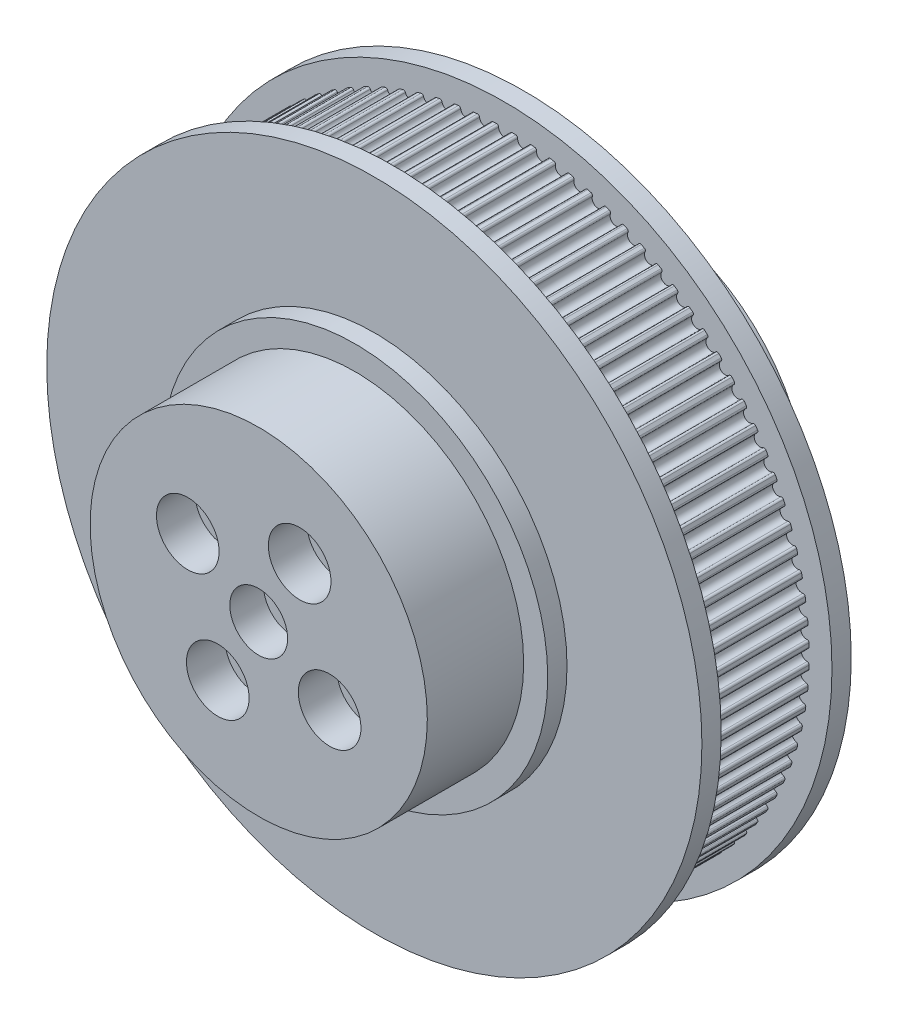
from build123d import *

# Parameters (mm, degrees)
SKETCHREVOLVEGEARBELT01_W       = 11.5
SKETCHREVOLVEGEARBELT01_H       = 31.640488143
TOOTHEXTRUDECUTGEARBELT01_DEPTH = 11.5
PATTERNGEARBELT01_COUNT         = 100
SKETCH_5_R                      = 34
EXTRUDE_1_DEPTH                 = 2
EXTRUDE_START                   = 2
SKETCH_20_R                     = 34
EXTRUDE_10_DEPTH                = 2
SKETCH_12_R                     = 20
EXTRUDE_5_DEPTH                 = 2
SKETCH_6_R                      = 20
EXTRUDE_6_DEPTH                 = 2
SKETCH_13_R                     = 17.5
EXTRUDE_7_DEPTH                 = 10
EXTRUDE_START_2                 = 10
SKETCH_14_R                     = 17.5
EXTRUDE_8_DEPTH                 = 10
SKETCH_15_R                     = 12
CUT_EXTRUDE_1_DEPTH             = 7
CUT_EXTRUDE_2_DEPTH             = 55.426556018
CUT_EXTRUDE_2_DEPTH_BACK        = 55.426556018
SKETCH_16_R                     = 1.75
SKETCH_17_R                     = 3.25
CUT_EXTRUDE_3_DEPTH             = 4
SKETCH_18_R                     = 3
CUT_EXTRUDE_4_DEPTH             = 3.5
CUT_EXTRUDE_5_DEPTH             = 55.426556018
CUT_EXTRUDE_5_DEPTH_BACK        = 55.426556018
SKETCH_19_R                     = 1


with BuildPart() as part:
    # SketchRevolveGearBelt01 → GearBelt01 (revolve)
    with BuildSketch(Plane(origin=(0, 0, 0), x_dir=(0, 0, -1), z_dir=(1, 0, 0))):
        with Locations((5.75, 15.820244072)):
            Rectangle(SKETCHREVOLVEGEARBELT01_W, SKETCHREVOLVEGEARBELT01_H)
    revolve(axis=Axis((0, 0, 0), (0, 0, -1)))

    # SketchToothGearBelt01 → ToothExtrudeCutGearBelt01 (cut)
    with BuildSketch(Plane.XY):
        with BuildLine():
            Line((-0.813963777, 31.630016644), (0, 34.180488105))
            Line((0, 34.180488105), (0.813963777, 31.630016644))
            ThreePointArc((0.813963777, 31.630016644), (0.663006412, 31.570874086), (0.599999991, 31.421488146))
            ThreePointArc((0.599999991, 31.421488146), (0, 30.821488155), (-0.599999991, 31.421488146))
            ThreePointArc((-0.599999991, 31.421488146), (-0.663006412, 31.570874086), (-0.813963777, 31.630016644))
        make_face()
    toothextrudecutgearbelt01 = extrude(amount=-TOOTHEXTRUDECUTGEARBELT01_DEPTH, mode=Mode.SUBTRACT)

    # PatternGearBelt01: ToothExtrudeCutGearBelt01 ×100 about axis
    patterngearbelt01_axis = Axis((0, 0, 55), (0, 0, -1))
    for i in range(1, PATTERNGEARBELT01_COUNT):
        add(toothextrudecutgearbelt01.rotate(patterngearbelt01_axis, i * 360 / PATTERNGEARBELT01_COUNT), mode=Mode.SUBTRACT)

    # Эскиз5 → Бобышка-Вытянуть1 (add)
    with BuildSketch(Plane(origin=(0, 0, 0), x_dir=(-1, 0, 0), z_dir=(0, 0, -1))):
        Circle(SKETCH_5_R)
    extrude(amount=-EXTRUDE_1_DEPTH)

    # Эскиз20 → Бобышка-Вытянуть10 (add)
    with BuildSketch(Plane(origin=(0, 0, -11.5), x_dir=(-1, 0, 0), z_dir=(0, 0, -1)).offset(EXTRUDE_START)):
        Circle(SKETCH_20_R)
    extrude(amount=-EXTRUDE_10_DEPTH)

    # Эскиз12 → Бобышка-Вытянуть5 (add)
    with BuildSketch(Plane(origin=(0, 0, -13.5), x_dir=(-1, 0, 0), z_dir=(0, 0, -1))):
        Circle(SKETCH_12_R)
    extrude(amount=EXTRUDE_5_DEPTH)

    # Эскиз6 → Бобышка-Вытянуть6 (add)
    with BuildSketch(Plane.XY.offset(2).offset(EXTRUDE_START)):
        Circle(SKETCH_6_R)
    extrude(amount=-EXTRUDE_6_DEPTH)

    # Эскиз13 → Бобышка-Вытянуть7 (add)
    with BuildSketch(Plane.XY.offset(4)):
        Circle(SKETCH_13_R)
    extrude(amount=EXTRUDE_7_DEPTH)

    # Эскиз14 → Бобышка-Вытянуть8 (add)
    with BuildSketch(Plane(origin=(0, 0, -15.5), x_dir=(-1, 0, 0), z_dir=(0, 0, -1)).offset(EXTRUDE_START_2)):
        Circle(SKETCH_14_R)
    extrude(amount=-EXTRUDE_8_DEPTH)

    # Эскиз15 → Вырез-Вытянуть1 (cut)
    with BuildSketch(Plane(origin=(0, 0, -25.5), x_dir=(-1, 0, 0), z_dir=(0, 0, -1))):
        Circle(SKETCH_15_R)
    extrude(amount=-CUT_EXTRUDE_1_DEPTH, mode=Mode.SUBTRACT)

    # Эскиз16 → Вырез-Вытянуть2 (cut, two sides: drawn at the far end of the back side and taken through both)
    with BuildSketch(Plane.XY.offset(-CUT_EXTRUDE_2_DEPTH_BACK)):
        with Locations((4.25, 7.361215932)):
            Circle(SKETCH_16_R)
        with Locations((7.361215932, -4.25)):
            Circle(SKETCH_16_R)
        with Locations((-4.25, -7.361215932)):
            Circle(SKETCH_16_R)
        with Locations((-7.361215932, 4.25)):
            Circle(SKETCH_16_R)
    extrude(amount=CUT_EXTRUDE_2_DEPTH + CUT_EXTRUDE_2_DEPTH_BACK, mode=Mode.SUBTRACT)

    # Эскиз17 → Вырез-Вытянуть3 (cut)
    with BuildSketch(Plane.XY.offset(14)):
        with Locations((4.25, 7.361215932)):
            Circle(SKETCH_17_R)
        with Locations((7.361215932, -4.25)):
            Circle(SKETCH_17_R)
        with Locations((-4.25, -7.361215932)):
            Circle(SKETCH_17_R)
        with Locations((-7.361215932, 4.25)):
            Circle(SKETCH_17_R)
    extrude(amount=-CUT_EXTRUDE_3_DEPTH, mode=Mode.SUBTRACT)

    # Эскиз18 → Вырез-Вытянуть4 (cut)
    with BuildSketch(Plane.XY.offset(14)):
        Circle(SKETCH_18_R)
    extrude(amount=-CUT_EXTRUDE_4_DEPTH, mode=Mode.SUBTRACT)

    # Эскиз19 → Вырез-Вытянуть5 (cut, two sides: drawn at the far end of the back side and taken through both)
    with BuildSketch(Plane.XY.offset(-CUT_EXTRUDE_5_DEPTH_BACK)):
        Circle(SKETCH_19_R)
    extrude(amount=CUT_EXTRUDE_5_DEPTH + CUT_EXTRUDE_5_DEPTH_BACK, mode=Mode.SUBTRACT)


solid = part.part
